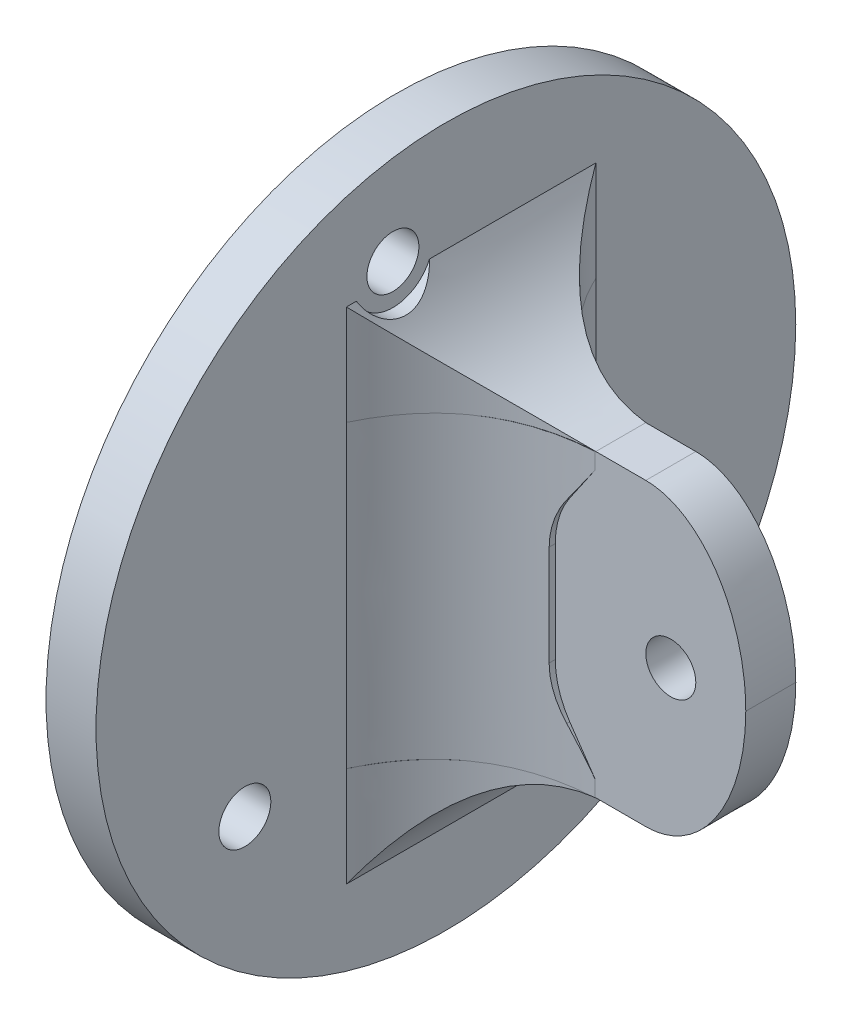
from build123d import *

# Parameters (mm, degrees)
SKIZZE1_W                            = 100
SKIZZE1_H                            = 100
AUFSATZ_LINEAR_AUSTRAGEN1_DEPTH      = 5
SKIZZE4_R                            = 2.6
SCHNITT_LINEAR_AUSTRAGEN1_DEPTH      = 10
SKIZZE5_W                            = 100
SKIZZE5_H                            = 100
SKIZZE5_R                            = 35
SCHNITT_LINEAR_AUSTRAGEN2_DEPTH      = 10
SKIZZE6_W                            = 5
SKIZZE6_H                            = 30
AUFSATZ_LINEAR_AUSTRAGEN2_DEPTH      = 30
SCHNITT_LINEAR_AUSTRAGEN3_REACH      = 65.256
SKIZZE7_R                            = 2.5
AUFSATZ_LINEAR_AUSTRAGEN3_DEPTH      = 30
AUFSATZ_LINEAR_AUSTRAGEN4_DEPTH      = 10
AUFSATZ_LINEAR_AUSTRAGEN4_DEPTH_BACK = 15
SCHNITT_LINEAR_AUSTRAGEN5_DEPTH      = 10
SCHNITT_LINEAR_AUSTRAGEN6_DEPTH      = 10
SKIZZE13_R                           = 4
SCHNITT_LINEAR_AUSTRAGEN7_DEPTH      = 5
VERRUNDUNG1_SIZE                     = 10
VERRUNDUNG1_SIZE_2                   = 15
VERRUNDUNG2_SIZE                     = 10
VERRUNDUNG2_SIZE_2                   = 15
SCHNITT_LINEAR_AUSTRAGEN8_DEPTH      = 10


with BuildPart() as part:
    # Skizze1 → Aufsatz-Linear austragen1 (new body)
    with BuildSketch(Plane(origin=(0, 0, 0), x_dir=(0, 0, -1), z_dir=(1, 0, 0))):
        with Locations((1.703406814, -6.613226453)):
            Rectangle(SKIZZE1_W, SKIZZE1_H)
    extrude(amount=AUFSATZ_LINEAR_AUSTRAGEN1_DEPTH)

    # Skizze4 → Schnitt-Linear austragen1 (cut)
    with BuildSketch(Plane.ZY):
        with Locations((3.596593186, 30)):
            Circle(SKIZZE4_R)
        with Locations((18.406499823, -10.689884067)):
            Circle(SKIZZE4_R)
        with Locations((-24.236926775, -3.170697408)):
            Circle(SKIZZE4_R)
    extrude(amount=-SCHNITT_LINEAR_AUSTRAGEN1_DEPTH, mode=Mode.SUBTRACT)

    # Skizze5 → Schnitt-Linear austragen2 (cut)
    with BuildSketch(Plane(origin=(5, 0, 0), x_dir=(0, 0, -1), z_dir=(1, 0, 0))):
        with Locations((1.703406814, -6.613226453)):
            Rectangle(SKIZZE5_W, SKIZZE5_H)
        with Locations((1.703406814, 4.386773547)):
            Circle(SKIZZE5_R, mode=Mode.SUBTRACT)
    extrude(amount=-SCHNITT_LINEAR_AUSTRAGEN2_DEPTH, mode=Mode.SUBTRACT)

    # Skizze6 → Aufsatz-Linear austragen2 (add)
    with BuildSketch(Plane(origin=(5, 0, 0), x_dir=(0, 0, -1), z_dir=(1, 0, 0))):
        with Locations((4.203406814, 3.386773547)):
            Rectangle(SKIZZE6_W, SKIZZE6_H)
    extrude(amount=AUFSATZ_LINEAR_AUSTRAGEN2_DEPTH)

    # Skizze7 → Schnitt-Linear austragen3 (cut, up to next)
    with BuildSketch(Plane.XY.offset(-1.703406814), mode=Mode.PRIVATE) as schnitt_linear_austragen3_sk1:
        with Locations((27.5, 3.386773547)):
            Circle(SKIZZE7_R)
    schnitt_linear_austragen3_tool1 = extrude(schnitt_linear_austragen3_sk1.sketch, amount=-SCHNITT_LINEAR_AUSTRAGEN3_REACH, mode=Mode.PRIVATE) & part.part
    add(schnitt_linear_austragen3_tool1.solids().sort_by_distance((27.5, 3.386774, -1.703407))[0], mode=Mode.SUBTRACT)

    # Skizze8 → Aufsatz-Linear austragen3 (add)
    with BuildSketch(Plane(origin=(0, 18.386773547, 0), x_dir=(1, 0, 0), z_dir=(0, 1, 0))):
        with BuildLine():
            Line((4.966438821, 1.677827842), (19.966438821, 1.677827842))
            add(Edge.make_bspline(
                [(4.966438821, -8.322172158), (9.326216657, 1.022140691), (19.966438821, 1.677827842)],
                knots=[0, 0, 0, 1, 1, 1], degree=2))
            Line((4.966438821, -8.322172158), (4.966438821, 1.677827842))
        make_face()
        with BuildLine():
            Line((5, 6.703406814), (20, 6.703406814))
            add(Edge.make_bspline(
                [(5, 16.703406814), (9.359777836, 7.359093965), (20, 6.703406814)],
                knots=[0, 0, 0, 1, 1, 1], degree=2))
            Line((5, 16.703406814), (5, 6.703406814))
        make_face()
    extrude(amount=-AUFSATZ_LINEAR_AUSTRAGEN3_DEPTH)

    # Skizze10 → Aufsatz-Linear austragen4 (add, two sides: drawn at the far end of the back side and taken through both)
    with BuildSketch(Plane(origin=(0, 0, -6.703406814), x_dir=(-1, 0, 0), z_dir=(0, 0, -1)).offset(-AUFSATZ_LINEAR_AUSTRAGEN4_DEPTH_BACK)):
        with BuildLine():
            Line((-20, 18.386773547), (-5, 18.386773547))
            Line((-5, 18.386773547), (-5, 28.386773547))
            add(Edge.make_bspline(
                [(-5, 28.386773547), (-9.359777836, 19.042460698), (-20, 18.386773547)],
                knots=[0, 0, 0, 1, 1, 1], degree=2))
        make_face()
        with BuildLine():
            Line((-20, -11.613226453), (-5, -11.613226453))
            Line((-5, -11.613226453), (-5, -21.613226453))
            add(Edge.make_bspline(
                [(-20, -11.613226453), (-9.359777836, -12.268913604), (-5, -21.613226453)],
                knots=[0, 0, 0, 1, 1, 1], degree=2))
        make_face()
    extrude(amount=AUFSATZ_LINEAR_AUSTRAGEN4_DEPTH + AUFSATZ_LINEAR_AUSTRAGEN4_DEPTH_BACK)

    # Skizze11 → Schnitt-Linear austragen5 (cut)
    with BuildSketch(Plane.XZ.offset(-18.386773547)):
        with BuildLine():
            Line((5, 8.296593186), (19.36962833, 8.296593186))
            Line((19.36962833, 8.296593186), (20, -1.703406814))
            add(Edge.make_bspline(
                [(4.99999999, 8.250566821), (9.460930964, -1.092308009), (20, -1.703406814)],
                knots=[0, 0, 0, 1, 1, 1], degree=2))
            Line((4.99999999, 8.250566821), (5, 8.296593186))
        make_face()
        with BuildLine():
            Line((5, -16.703406814), (20, -16.703406814))
            Line((20, -16.703406814), (20, -6.703406814))
            add(Edge.make_bspline(
                [(5, -16.703406814), (9.435333182, -7.304303218), (20, -6.703406814)],
                knots=[0, 0, 0, 1, 1, 1], degree=2))
        make_face()
    extrude(amount=-SCHNITT_LINEAR_AUSTRAGEN5_DEPTH, mode=Mode.SUBTRACT)


with BuildPart() as schnitt_linear_austragen5_kept_piece:
    # of the separate pieces the step leaves, the one the design keeps (schnitt_linear_austragen5_pieces_kept)
    add(part.part.solids().sort_by_distance((0, 4.386773547, -36.703406814))[0])

    # Skizze12 → Schnitt-Linear austragen6 (cut)
    with BuildSketch(Plane(origin=(0, -11.613226453, 0), x_dir=(1, 0, 0), z_dir=(0, 1, 0))):
        with BuildLine():
            Line((20, 6.703406814), (20, 16.703406814))
            Line((20, 16.703406814), (5, 16.703406814))
            add(Edge.make_bspline(
                [(20, 6.703406814), (9.435333182, 7.304303218), (5, 16.703406814)],
                knots=[0, 0, 0, 1, 1, 1], degree=2))
        make_face()
        with BuildLine():
            Line((5, -8.296593186), (20, -8.296593186))
            Line((20, -8.296593186), (20, 1.703406814))
            add(Edge.make_bspline(
                [(5, -8.250408851), (9.461034282, 1.092291552), (20, 1.703406814)],
                knots=[0, 0, 0, 1, 1, 1], degree=2))
            Line((5, -8.250408851), (5, -8.296593186))
        make_face()
    extrude(amount=-SCHNITT_LINEAR_AUSTRAGEN6_DEPTH, mode=Mode.SUBTRACT)

    # Skizze13 → Schnitt-Linear austragen7 (cut)
    with BuildSketch(Plane(origin=(5, 0, 0), x_dir=(0, 0, -1), z_dir=(1, 0, 0))):
        with Locations((-3.596593186, 30)):
            Circle(SKIZZE13_R)
    extrude(amount=SCHNITT_LINEAR_AUSTRAGEN7_DEPTH, mode=Mode.SUBTRACT)

    # Verrundung1
    # an asymmetric fillet: 15, 10 mm, written as the material it takes off along each edge
    with BuildSketch(Plane(origin=(35, 18.386773547, 35.796593186), x_dir=(-1, 0, 0), z_dir=(0, 0, -1))) as verrundung1_piece_1:
        with BuildLine():
            Bezier((VERRUNDUNG1_SIZE, 0), (0, 0), (0, -VERRUNDUNG1_SIZE_2), weights=[1, 0.707106781, 1])
            Line((0, -VERRUNDUNG1_SIZE_2), (0, 0))
            Line((0, 0), (VERRUNDUNG1_SIZE, 0))
        make_face()
    extrude(amount=80, mode=Mode.SUBTRACT)

    # Verrundung2
    # an asymmetric fillet: 15, 10 mm, written as the material it takes off along each edge
    with BuildSketch(Plane(origin=(35, -11.613226453, -44.203406814), x_dir=(-1, 0, 0), z_dir=(0, 0, 1))) as verrundung2_piece_1:
        with BuildLine():
            Bezier((VERRUNDUNG2_SIZE, 0), (0, 0), (0, -VERRUNDUNG2_SIZE_2), weights=[1, 0.707106781, 1])
            Line((0, -VERRUNDUNG2_SIZE_2), (0, 0))
            Line((0, 0), (VERRUNDUNG2_SIZE, 0))
        make_face()
    extrude(amount=80, mode=Mode.SUBTRACT)

    # Skizze14 → Schnitt-Linear austragen8 (cut)
    with BuildSketch(Plane.XY.offset(-1.703406814)):
        with BuildLine():
            Line((19.966438821, 16.786773547), (17.417610755, 13.078205698))
            ThreePointArc((17.417610755, 13.078205698), (16.337578752, 10.851495421), (15.966438821, 8.404668304))
            Line((15.966438821, 8.404668304), (15.966438821, -1.634503602))
            ThreePointArc((15.966438821, -1.634503602), (16.337441855, -4.079814875), (17.417059118, -6.305037794))
            Line((17.417059118, -6.305037794), (19.966438821, -10.013226453))
            Line((19.966438821, -10.013226453), (19.966438821, 16.786773547))
        make_face()
    extrude(amount=SCHNITT_LINEAR_AUSTRAGEN8_DEPTH, mode=Mode.SUBTRACT)


solid = schnitt_linear_austragen5_kept_piece.part
